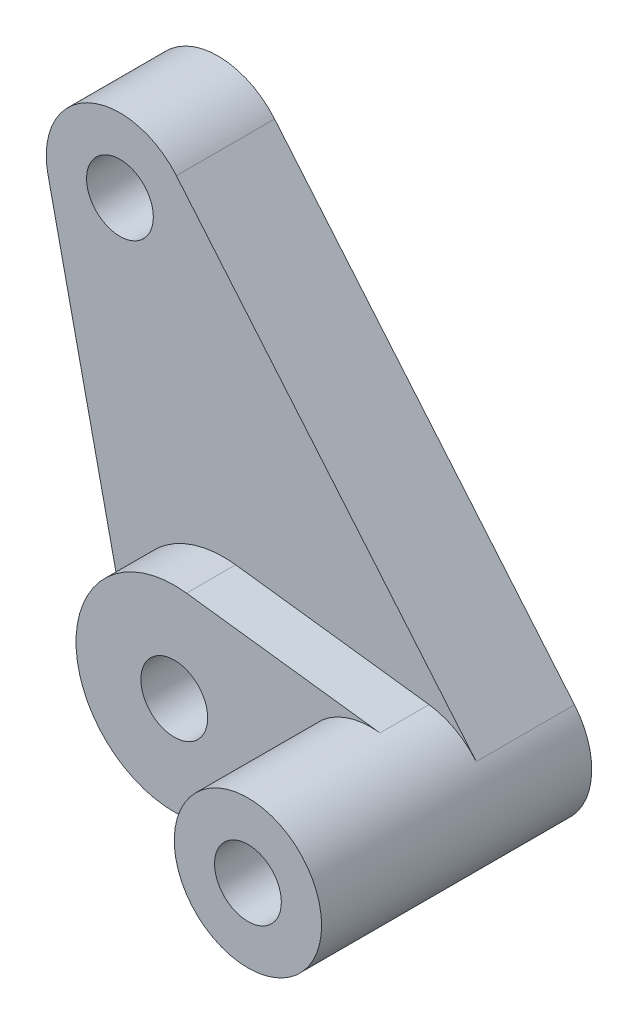
from build123d import *

# Parameters (mm, degrees)
SKETCH1_R           = 2.159
BOSS_EXTRUDE1_DEPTH = 3.175
SKETCH3_R           = 4.7625
SKETCH3_R_2         = 2.159
BOSS_EXTRUDE2_DEPTH = 11.1125
CUT_EXTRUDE1_DEPTH  = 3.175
BOSS_EXTRUDE3_START = 3.175
SKETCH5_R           = 2.159
BOSS_EXTRUDE3_DEPTH = 3.175


with BuildPart() as part:
    # Sketch1 → Boss-Extrude1 (new, symmetric)
    with BuildSketch(Plane.XY):
        with BuildLine():
            Line((0.5953125, -4.725146482), (-11.90625, -6.300195309))
            ThreePointArc((-11.90625, -6.300195309), (-16.363061356, -5.186953008), (-18.902837212, -1.359158018))
            Line((-18.902837212, -1.359158018), (-24.040209186, 22.086447002))
            ThreePointArc((-24.040209186, 22.086447002), (-21.489233153, 27.379755974), (-15.739794617, 26.167091507))
            Line((-15.739794617, 26.167091507), (3.64828666, 3.061275991))
            ThreePointArc((3.64828666, 3.061275991), (4.433861431, -1.738470321), (0.5953125, -4.725146482))
        make_face()
        with Locations((-12.7, 0)):
            Circle(SKETCH1_R, mode=Mode.SUBTRACT)
        with Locations((-19.388081277, 23.105815516)):
            Circle(SKETCH1_R, mode=Mode.SUBTRACT)
        Circle(SKETCH1_R, mode=Mode.SUBTRACT)
    extrude(amount=BOSS_EXTRUDE1_DEPTH, both=True)

    # Sketch3 → Boss-Extrude2 (add)
    with BuildSketch(Plane.XY.offset(3.175)):
        Circle(SKETCH3_R)
        Circle(SKETCH3_R_2, mode=Mode.SUBTRACT)
    extrude(amount=BOSS_EXTRUDE2_DEPTH)

    # Sketch4 → Cut-Extrude1 (cut)
    with BuildSketch(Plane(origin=(0, 0, -3.175), x_dir=(-1, 0, 0), z_dir=(0, 0, -1))):
        Polygon((12.7, 5.132643893), (8.255, 2.566321947), (8.255, -2.566321947), (12.7, -5.132643893), (17.145, -2.566321947), (17.145, 2.566321947), align=None)
    extrude(amount=-CUT_EXTRUDE1_DEPTH, mode=Mode.SUBTRACT)

    # Sketch5 → Boss-Extrude3 (add)
    with BuildSketch(Plane.XY.offset(3.175).offset(BOSS_EXTRUDE3_START)):
        with BuildLine():
            Line((-11.90625, 6.300195309), (0.5953125, 4.725146482))
            ThreePointArc((0.5953125, 4.725146482), (-4.7625, 0), (0.5953125, -4.725146482))
            Line((0.5953125, -4.725146482), (-11.90625, -6.300195309))
            ThreePointArc((-11.90625, -6.300195309), (-19.05, 0), (-11.90625, 6.300195309))
        make_face()
        with Locations((-12.7, 0)):
            Circle(SKETCH5_R, mode=Mode.SUBTRACT)
    extrude(amount=-BOSS_EXTRUDE3_DEPTH)


solid = part.part
